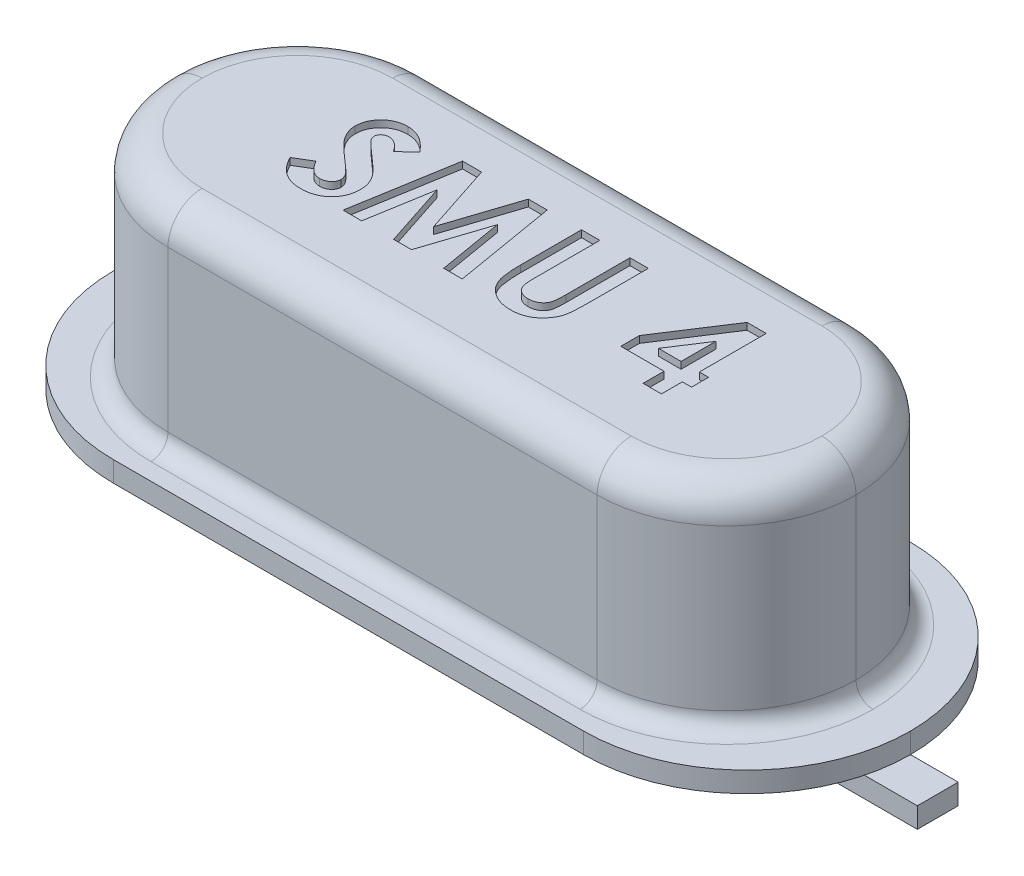
from build123d import *

# Parameters (mm, degrees)
ESBO_O1_W       = 11.7
ESBO_O1_H       = 4.8
EXTRUS_O1_DEPTH = 0.3
FILETE1_R       = 2.4
ESBO_O7_W       = 0.3
ESBO_O7_H       = 0.6
EXTRUS_O2_DEPTH = 0.6
ESBO_O8_W       = 0.6
ESBO_O8_H       = 0.3
EXTRUS_O3_DEPTH = 3.55
ESBO_O9_W       = 0.6
ESBO_O9_H       = 0.3
EXTRUS_O4_DEPTH = 3.55
FILETE2_R       = 0.3
ESBO_O11_W      = 10.1
ESBO_O11_H      = 3.8
EXTRUS_O5_DEPTH = 3.1
FILETE3_R       = 1.9
FILETE4_R       = 0.25
FILETE5_R       = 0.5
EXTRUS_O6_DEPTH = 0.1


# Some blends are built 0.0001 mm under size
with BuildPart() as part:
    # Esboço1 → Extrusão1 (new body)
    with BuildSketch(Plane(origin=(0, 0, 0), x_dir=(1, 0, 0), z_dir=(0, 1, 0))):
        Rectangle(ESBO_O1_W, ESBO_O1_H)
    extrude(amount=EXTRUS_O1_DEPTH)

    # Filete1
    filete1_edges = [part.edges().sort_by_distance(p)[0] for p in [
        (-5.85, 0.15, 2.4),
        (-5.85, 0.15, -2.4),
        (5.85, 0.15, -2.4),
        (5.85, 0.15, 2.4),
    ]]
    fillet(filete1_edges, radius=FILETE1_R - 0.0001)  # a hair under: the kernel refuses the full size

    # Esboço7 → Extrusão2 (add)
    with BuildSketch(Plane.XZ):
        with Locations((-2.55, 0)):
            Rectangle(ESBO_O7_W, ESBO_O7_H)
        with Locations((2.55, 0)):
            Rectangle(ESBO_O7_W, ESBO_O7_H)
    extrude(amount=EXTRUS_O2_DEPTH)

    # Esboço8 → Extrusão3 (add)
    with BuildSketch(Plane.ZY.offset(2.7)):
        with Locations((0, -0.45)):
            Rectangle(ESBO_O8_W, ESBO_O8_H)
    extrude(amount=EXTRUS_O3_DEPTH)

    # Esboço9 → Extrusão4 (add)
    with BuildSketch(Plane(origin=(2.7, 0, 0), x_dir=(0, 0, -1), z_dir=(1, 0, 0))):
        with Locations((0, -0.45)):
            Rectangle(ESBO_O9_W, ESBO_O9_H)
    extrude(amount=EXTRUS_O4_DEPTH)

    # Filete2
    filete2_edges = [part.edges().sort_by_distance(p)[0] for p in [
        (-2.4, -0.6, 0),
        (2.4, -0.6, 0),
    ]]
    fillet(filete2_edges, radius=FILETE2_R)

    # Esboço11 → Extrusão5 (add)
    with BuildSketch(Plane(origin=(0, 0.3, 0), x_dir=(1, 0, 0), z_dir=(0, 1, 0))):
        Rectangle(ESBO_O11_W, ESBO_O11_H)
    extrude(amount=EXTRUS_O5_DEPTH)

    # Filete3
    # the kernel refuses this fillet: 1.9 mm, written as the material it takes off along each edge
    with BuildSketch(Plane(origin=(-5.05, 0.3, -1.9), x_dir=(1, 0, 0), z_dir=(0, 1, 0)), Plane(origin=(-5.05, 0.3, 1.9), x_dir=(0, 0, -1), z_dir=(0, 1, 0))) as filete3_piece_1:
        with BuildLine():
            CenterArc((FILETE3_R, -FILETE3_R), FILETE3_R, 90, 90)
            Line((0, -FILETE3_R), (0, 0))
            Line((0, 0), (FILETE3_R, 0))
        make_face()
    extrude(amount=7.85, mode=Mode.SUBTRACT)
    with BuildSketch(Plane(origin=(5.05, 0.3, 1.9), x_dir=(0, 0, -1), z_dir=(0, 1, 0)), Plane(origin=(5.05, 0.3, -1.9), x_dir=(-1, 0, 0), z_dir=(0, 1, 0))) as filete3_piece_2:
        with BuildLine():
            CenterArc((FILETE3_R, FILETE3_R), FILETE3_R, 180, 90)
            Line((0, FILETE3_R), (0, 0))
            Line((0, 0), (FILETE3_R, 0))
        make_face()
    extrude(amount=7.85, mode=Mode.SUBTRACT)

    # Filete4
    filete4_edges = [part.edges().sort_by_distance(p)[0] for p in [
        (0, 0.3, -1.9),
        (0, 0.3, 1.9),
        (-5.05, 0.3, 0),
        (-5.05, 0.3, 0),
        (5.05, 0.3, 0),
        (5.05, 0.3, 0),
    ]]
    fillet(filete4_edges, radius=FILETE4_R)

    # Filete5
    filete5_edges = [part.edges().sort_by_distance(p)[0] for p in [
        (0, 3.4, -1.9),
        (0, 3.4, 1.9),
        (5.05, 3.4, 0),
        (5.05, 3.4, 0),
        (-5.05, 3.4, 0),
        (-5.05, 3.4, 0),
    ]]
    fillet(filete5_edges, radius=FILETE5_R)

    # Esboço12 → Extrusão6 (cut)
    # profile 1 of 4: a face of its own
    with BuildSketch(Plane(origin=(0, 3.4, 0), x_dir=(1, 0, 0), z_dir=(0, 1, 0))):
        with BuildLine():
            Line((-2.010249789, 0.656909087), (-2.211571904, 0.472714375))
            add(Edge.make_bspline(
                [(-2.211571904, 0.472714375), (-2.22019568, 0.484879108), (-2.236752128, 0.508233698), (-2.263588403, 0.539506046), (-2.290303498, 0.566183685), (-2.317144913, 0.58815517), (-2.344350559, 0.605287007), (-2.371873212, 0.617416537), (-2.399556838, 0.625127394), (-2.418155961, 0.626087582), (-2.427317096, 0.626560529)],
                knots=[0, 0, 0, 0, 1.299362458, 2.494594718, 3.587462134, 4.587049575, 5.512617175, 6.380583204, 7.202344345, 8, 8, 8, 8], degree=3))
            add(Edge.make_bspline(
                [(-2.427317096, 0.626560529), (-2.43586234, 0.626260848), (-2.452360961, 0.625682242), (-2.47588097, 0.619930947), (-2.496762368, 0.610005056), (-2.514984777, 0.597026119), (-2.529419613, 0.581389508), (-2.540944711, 0.564990724), (-2.547434309, 0.546890175), (-2.548288468, 0.534457987), (-2.548711327, 0.528303317)],
                knots=[0, 0, 0, 0, 1.185010067, 2.2879431, 3.333075148, 4.379039566, 5.372662701, 6.27520591, 7.14612461, 8, 8, 8, 8], degree=3))
            add(Edge.make_bspline(
                [(-2.548711327, 0.528303317), (-2.548446343, 0.522059894), (-2.547912701, 0.509486507), (-2.542758446, 0.491058643), (-2.534989513, 0.473052475), (-2.52756598, 0.462091263), (-2.523771423, 0.456488413)],
                knots=[0, 0, 0, 0, 0.967525499, 1.948461899, 2.951351359, 4, 4, 4, 4], degree=3))
            add(Edge.make_bspline(
                [(-2.523771423, 0.456488413), (-2.520321761, 0.452133377), (-2.512381093, 0.442108658), (-2.497239866, 0.426231067), (-2.478225666, 0.406779627), (-2.454606784, 0.384423217), (-2.427363707, 0.358357814), (-2.395233682, 0.329608057), (-2.359141551, 0.297283601), (-2.333488101, 0.274774021), (-2.320045462, 0.262978798)],
                knots=[0, 0, 0, 0, 0.473873513, 1.090794244, 1.870441696, 2.795289791, 3.865433203, 5.087734844, 6.473946851, 8, 8, 8, 8], degree=3))
            add(Edge.make_bspline(
                [(-2.320045462, 0.262978798), (-2.307427612, 0.252058685), (-2.283481553, 0.23133458), (-2.249411068, 0.201920039), (-2.219468785, 0.175456495), (-2.193218515, 0.152341107), (-2.171058186, 0.132331342), (-2.152894636, 0.115331555), (-2.138506027, 0.101672699), (-2.130326946, 0.093422742), (-2.126836327, 0.089901875)],
                knots=[0, 0, 0, 0, 1.543621617, 2.929473131, 4.163658386, 5.240097082, 6.164993805, 6.925417477, 7.541396219, 8, 8, 8, 8], degree=3))
            add(Edge.make_bspline(
                [(-2.126836327, 0.089901875), (-2.113593648, 0.07557046), (-2.088136568, 0.048020448), (-2.055051339, 0.005326593), (-2.027821125, -0.036351315), (-2.006755315, -0.077797513), (-1.990845568, -0.119609988), (-1.979628986, -0.162814188), (-1.9729113, -0.20786157), (-1.97216548, -0.238600909), (-1.97178825, -0.254148606)],
                knots=[0, 0, 0, 0, 1.206664779, 2.319633467, 3.337109185, 4.282041471, 5.190008762, 6.099243693, 7.03861361, 8, 8, 8, 8], degree=3))
            add(Edge.make_bspline(
                [(-1.97178825, -0.254148606), (-1.972056753, -0.269297929), (-1.972583564, -0.299021466), (-1.979035993, -0.342517434), (-1.988236778, -0.384144963), (-2.002462806, -0.423451087), (-2.019801404, -0.461081004), (-2.041537841, -0.496448559), (-2.067064306, -0.529911687), (-2.096321555, -0.560872192), (-2.128683546, -0.588966706), (-2.163394856, -0.613977105), (-2.200794912, -0.634626375), (-2.240564172, -0.651629576), (-2.282681348, -0.664725669), (-2.327096268, -0.674404902), (-2.373876865, -0.680214225), (-2.405866112, -0.680821521), (-2.422208923, -0.681131779)],
                knots=[0, 0, 0, 0, 1.043214005, 2.046824704, 3.02475056, 3.976699089, 4.921714032, 5.875962561, 6.831408892, 7.817874052, 8.806269674, 9.781291748, 10.760897367, 11.74438705, 12.757449933, 13.795994037, 14.874007457, 16, 16, 16, 16], degree=3))
            add(Edge.make_bspline(
                [(-2.422208923, -0.681131779), (-2.435037891, -0.680904184), (-2.460446604, -0.680453417), (-2.497895206, -0.676773275), (-2.534056065, -0.670833919), (-2.568888448, -0.662321046), (-2.602549282, -0.651534082), (-2.635039949, -0.638358219), (-2.666136155, -0.622589236), (-2.696073189, -0.604551405), (-2.724705519, -0.583607107), (-2.752395191, -0.560184542), (-2.778867165, -0.53392346), (-2.804248579, -0.504885968), (-2.828377037, -0.472989838), (-2.852042349, -0.438679282), (-2.874192758, -0.401317544), (-2.887876051, -0.375107983), (-2.894865173, -0.361720721)],
                knots=[0, 0, 0, 0, 1.016823716, 2.013894106, 2.979844003, 3.91962641, 4.853723003, 5.779685073, 6.695824784, 7.614987388, 8.547259901, 9.504950863, 10.487499108, 11.500346958, 12.559593716, 13.656357062, 14.802919212, 16, 16, 16, 16], degree=3))
            Line((-2.894865173, -0.361720721), (-2.658086327, -0.219593317))
            add(Edge.make_bspline(
                [(-2.658086327, -0.219593317), (-2.64934398, -0.234789609), (-2.632584153, -0.263922199), (-2.604183059, -0.303065525), (-2.575087588, -0.336585305), (-2.544625079, -0.363889074), (-2.513165945, -0.385341919), (-2.48055823, -0.400673609), (-2.446779025, -0.410163909), (-2.423770166, -0.411322893), (-2.412293058, -0.41190101)],
                knots=[0, 0, 0, 0, 1.283663364, 2.460892379, 3.537111102, 4.529833553, 5.449777664, 6.316464042, 7.160231139, 8, 8, 8, 8], degree=3))
            add(Edge.make_bspline(
                [(-2.412293058, -0.41190101), (-2.400619196, -0.411428889), (-2.377970204, -0.410512905), (-2.345641666, -0.402052242), (-2.316001638, -0.38876838), (-2.290381017, -0.369814142), (-2.268687091, -0.347938069), (-2.252675728, -0.323599938), (-2.242617281, -0.297266668), (-2.24155386, -0.278973847), (-2.24101902, -0.269773606)],
                knots=[0, 0, 0, 0, 1.13588714, 2.203786484, 3.234766741, 4.283437687, 5.291419208, 6.222934724, 7.106237994, 8, 8, 8, 8], degree=3))
            add(Edge.make_bspline(
                [(-2.24101902, -0.269773606), (-2.241512923, -0.261214279), (-2.242516239, -0.243826825), (-2.24990636, -0.217974477), (-2.261459374, -0.192133887), (-2.275127403, -0.170938735), (-2.289036334, -0.15319261), (-2.30233641, -0.137816394), (-2.318532384, -0.120828368), (-2.33758319, -0.102207162), (-2.359237118, -0.081788848), (-2.383512407, -0.059575426), (-2.410687037, -0.03576257), (-2.429894119, -0.019541487), (-2.439937289, -0.011059663)],
                knots=[0, 0, 0, 0, 0.916159276, 1.861089862, 2.860218735, 3.940849679, 4.552606315, 5.27541173, 6.11797699, 7.06649574, 8.129236253, 9.306560635, 10.591630461, 12, 12, 12, 12], degree=3))
            add(Edge.make_bspline(
                [(-2.439937289, -0.011059663), (-2.459029754, 0.005094393), (-2.495673975, 0.036098918), (-2.547456907, 0.081891624), (-2.594117966, 0.124689104), (-2.635254136, 0.165020428), (-2.671389556, 0.20214077), (-2.7022795, 0.236351636), (-2.72758463, 0.267916915), (-2.754212822, 0.305303877), (-2.779514929, 0.350862458), (-2.801383129, 0.405674712), (-2.815570294, 0.460480012), (-2.817159769, 0.497273271), (-2.817942096, 0.515382644)],
                knots=[0, 0, 0, 0, 1.345494975, 2.582412109, 3.71882943, 4.751509156, 5.681369928, 6.505683931, 7.230279997, 7.856715994, 8.973648664, 10.023341002, 11.027102913, 12, 12, 12, 12], degree=3))
            add(Edge.make_bspline(
                [(-2.817942096, 0.515382644), (-2.817616727, 0.52822484), (-2.816975715, 0.553525344), (-2.811257789, 0.590726049), (-2.802712131, 0.626621604), (-2.790301382, 0.661081045), (-2.774193728, 0.69406121), (-2.754631608, 0.725723552), (-2.73131126, 0.755776656), (-2.705030801, 0.784200601), (-2.676076464, 0.810176852), (-2.645135076, 0.833103496), (-2.612381766, 0.852467673), (-2.578016905, 0.868531664), (-2.541827546, 0.880827629), (-2.504080295, 0.889543622), (-2.464721011, 0.894727616), (-2.437949676, 0.89543232), (-2.424312289, 0.895791298)],
                knots=[0, 0, 0, 0, 1.010766082, 1.991317756, 2.957454644, 3.913069143, 4.869106762, 5.843196583, 6.838735724, 7.860187025, 8.887984031, 9.89767229, 10.887916223, 11.879572884, 12.879850636, 13.892031539, 14.926195476, 16, 16, 16, 16], degree=3))
            add(Edge.make_bspline(
                [(-2.424312289, 0.895791298), (-2.406638911, 0.895144768), (-2.371431661, 0.893856812), (-2.319376728, 0.883785416), (-2.268531646, 0.867947084), (-2.227559726, 0.848839879), (-2.194959134, 0.830330721), (-2.169973825, 0.813289819), (-2.144549929, 0.793768551), (-2.118482417, 0.771705398), (-2.092255664, 0.746684664), (-2.065123917, 0.719301985), (-2.037456882, 0.689320711), (-2.019477695, 0.667902229), (-2.010249789, 0.656909087)],
                knots=[0, 0, 0, 0, 1.282922637, 2.555718331, 3.837320111, 5.142675274, 5.830281639, 6.55870424, 7.337177975, 8.157850921, 9.037902056, 9.96903443, 10.957596896, 12, 12, 12, 12], degree=3))
        make_face()
    # profile 2 of 4: a face of its own
    with BuildSketch(Plane(origin=(0, 3.4, 0), x_dir=(1, 0, 0), z_dir=(0, 1, 0))):
        Polygon((-1.583867577, 0.85732976), (-1.304420462, 0.85732976), (-0.962172866, -0.188944279), (-0.617521423, 0.85732976), (-0.340778635, 0.85732976), (-0.087172866, -0.64267024), (-0.359708923, -0.64267024), (-0.519865173, 0.304745625), (-0.831764212, -0.64267024), (-1.094384404, -0.64267024), (-1.404480558, 0.304745625), (-1.564336327, -0.64267024), (-1.837172866, -0.64267024), align=None)
    # profile 3 of 4: a face of its own
    with BuildSketch(Plane(origin=(0, 3.4, 0), x_dir=(1, 0, 0), z_dir=(0, 1, 0))):
        with BuildLine():
            Line((0.162827134, 0.85732976), (0.432057904, 0.85732976))
            Line((0.432057904, 0.85732976), (0.432057904, -0.118631779))
            add(Edge.make_bspline(
                [(0.432057904, -0.118631779), (0.432072543, -0.128750125), (0.432100819, -0.148293605), (0.433516327, -0.176332101), (0.434811614, -0.20210535), (0.43714868, -0.225585135), (0.440601327, -0.2467815), (0.443944616, -0.265830602), (0.448469427, -0.282391391), (0.455269495, -0.301241903), (0.465746168, -0.322421484), (0.482864469, -0.344495329), (0.502617524, -0.364640916), (0.526292699, -0.38140934), (0.552901502, -0.394973483), (0.582297728, -0.405023012), (0.614439941, -0.410609216), (0.636664519, -0.411462052), (0.648103577, -0.41190101)],
                knots=[0, 0, 0, 0, 1.155499968, 2.231836252, 3.205919964, 4.102923608, 4.924856345, 5.658536265, 6.31071849, 6.882491295, 7.94666036, 8.992281882, 10.060072772, 11.158554251, 12.289267114, 13.461410017, 14.693379945, 16, 16, 16, 16], degree=3))
            add(Edge.make_bspline(
                [(0.648103577, -0.41190101), (0.660256164, -0.411546388), (0.683951652, -0.410854937), (0.71803384, -0.404067592), (0.74961118, -0.393259814), (0.778015072, -0.377834362), (0.803217251, -0.359344253), (0.824550367, -0.338259735), (0.841386384, -0.314538754), (0.852359474, -0.292654343), (0.858520323, -0.272511648), (0.863138186, -0.254514915), (0.866523591, -0.233280551), (0.869594942, -0.209140177), (0.871440587, -0.181843745), (0.873441888, -0.151610776), (0.874175383, -0.118234409), (0.874300402, -0.094993818), (0.874365596, -0.082874567)],
                knots=[0, 0, 0, 0, 1.261321664, 2.459363699, 3.594844139, 4.716940403, 5.803436589, 6.833651888, 7.818396249, 8.814403945, 9.360733334, 10.004355033, 10.743453831, 11.592799886, 12.532235708, 13.585170094, 14.740740724, 16, 16, 16, 16], degree=3))
            Line((0.874365596, -0.082874567), (0.874365596, 0.85732976))
            Line((0.874365596, 0.85732976), (1.143596365, 0.85732976))
            Line((1.143596365, 0.85732976), (1.143596365, -0.037501971))
            add(Edge.make_bspline(
                [(1.143596365, -0.037501971), (1.143558977, -0.055631219), (1.143487085, -0.090491995), (1.14238303, -0.140589384), (1.140032697, -0.186345312), (1.138058688, -0.22777315), (1.134238305, -0.264817087), (1.130258363, -0.297635313), (1.125185584, -0.326111525), (1.117637593, -0.358528233), (1.104611996, -0.395854884), (1.083613026, -0.438834905), (1.056956192, -0.480914949), (1.025449147, -0.521632107), (0.989874811, -0.559457034), (0.951021943, -0.592662424), (0.90950782, -0.620750603), (0.864898647, -0.643034782), (0.817232389, -0.660414762), (0.766037426, -0.672093232), (0.711348667, -0.679983354), (0.673574107, -0.680741297), (0.654113192, -0.681131779)],
                knots=[0, 0, 0, 0, 1.170808336, 2.251350247, 3.235597562, 4.129743112, 4.929140599, 5.639994148, 6.264258765, 6.79612947, 7.788252245, 8.809469599, 9.879094798, 10.999557536, 12.129761673, 13.226370002, 14.293821979, 15.358369427, 16.438775801, 17.562147481, 18.744053101, 20, 20, 20, 20], degree=3))
            add(Edge.make_bspline(
                [(0.654113192, -0.681131779), (0.641182973, -0.680913986), (0.615671916, -0.680484286), (0.578153431, -0.676695454), (0.541884445, -0.67111214), (0.506933107, -0.66296666), (0.473178109, -0.652444221), (0.440628417, -0.639491832), (0.409404994, -0.624181739), (0.379682563, -0.606654761), (0.351497698, -0.587702353), (0.325738187, -0.56669281), (0.301517584, -0.545179868), (0.279535611, -0.522258171), (0.259627166, -0.498168357), (0.241833249, -0.472855832), (0.226180296, -0.446322844), (0.212274567, -0.418091136), (0.200372619, -0.386725794), (0.19033883, -0.351111139), (0.181573076, -0.310688947), (0.175058885, -0.265368149), (0.169153081, -0.215298118), (0.165415032, -0.160348412), (0.163459491, -0.100517456), (0.163043246, -0.059037895), (0.162827134, -0.037501971)],
                knots=[0, 0, 0, 0, 1.001158378, 1.975264943, 2.917723546, 3.841610987, 4.75185031, 5.653588123, 6.552117133, 7.442167995, 8.324307438, 9.179605724, 10.014504199, 10.831958861, 11.636465792, 12.43274043, 13.225645099, 14.020104002, 14.867201867, 15.819789774, 16.883317127, 18.068162734, 19.364263498, 20.787406516, 22.332041935, 24, 24, 24, 24], degree=3))
            Line((0.162827134, -0.037501971), (0.162827134, 0.85732976))
        make_face()
    # profile 4 of 4: a face of its own
    with BuildSketch(Plane(origin=(0, 3.4, 0), x_dir=(1, 0, 0), z_dir=(0, 1, 0))):
        Polygon((2.555255019, 0.895791298), (2.835904057, 0.895791298), (2.835904057, -0.084977933), (2.970519442, -0.084977933), (2.970519442, -0.334977933), (2.835904057, -0.334977933), (2.835904057, -0.64267024), (2.566673288, -0.64267024), (2.566673288, -0.334977933), (1.932057904, -0.334977933), (1.932057904, -0.062441875), align=None)
        Polygon((2.566673288, -0.084977933), (2.566673288, 0.425538894), (2.234642038, -0.084977933), align=None, mode=Mode.SUBTRACT)
    extrude(amount=-EXTRUS_O6_DEPTH, mode=Mode.SUBTRACT)


solid = part.part
